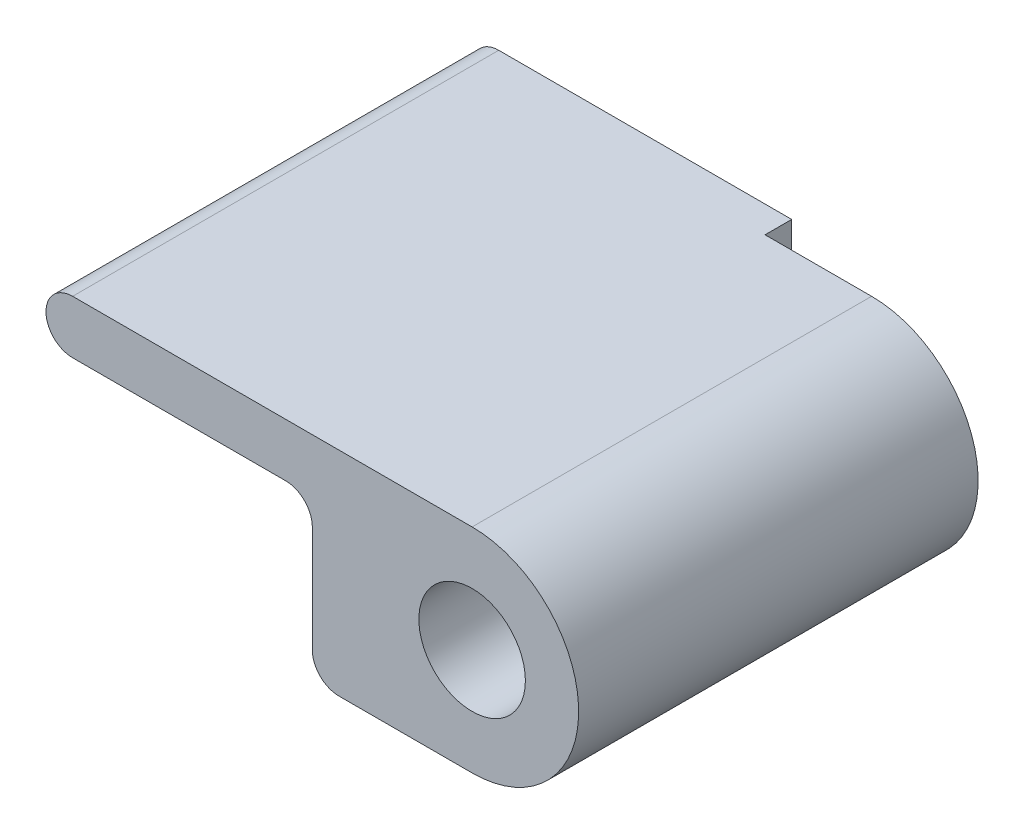
from build123d import *

# Parameters (mm, degrees)
SKETCH1_R           = 3.175
BOSS_EXTRUDE1_DEPTH = 25.4
CUT_EXTRUDE1_START  = -25.4
SKETCH2_W           = 12.7
SKETCH2_H           = 12.7
CUT_EXTRUDE1_DEPTH  = 1.5875
FILLET1_R           = 1.5875


with BuildPart() as part:
    # Sketch1 → Boss-Extrude1 (new body)
    with BuildSketch(Plane.XY):
        with BuildLine():
            Line((-25.4, 3.175), (-9.525, 3.175))
            Line((-9.525, 3.175), (-9.525, -6.35))
            Line((-9.525, -6.35), (0, -6.35))
            ThreePointArc((0, -6.35), (6.35, 0), (0, 6.35))
            Line((0, 6.35), (-25.4, 6.35))
            Line((-25.4, 6.35), (-25.4, 3.175))
        make_face()
        Circle(SKETCH1_R, mode=Mode.SUBTRACT)
    extrude(amount=BOSS_EXTRUDE1_DEPTH)

    # Sketch2 → Cut-Extrude1 (cut)
    with BuildSketch(Plane.XY.offset(25.4).offset(CUT_EXTRUDE1_START)):
        Rectangle(SKETCH2_W, SKETCH2_H)
    extrude(amount=CUT_EXTRUDE1_DEPTH, mode=Mode.SUBTRACT)

    # Fillet1
    fillet1_edges = [part.edges().sort_by_distance(p)[0] for p in [
        (-9.525, -6.35, 12.7),
        (-9.525, 3.175, 12.7),
        (-25.4, 6.35, 12.7),
        (-25.4, 3.175, 12.7),
    ]]
    fillet(fillet1_edges, radius=FILLET1_R - 0.0001)  # a hair under: the kernel refuses the full size


solid = part.part
